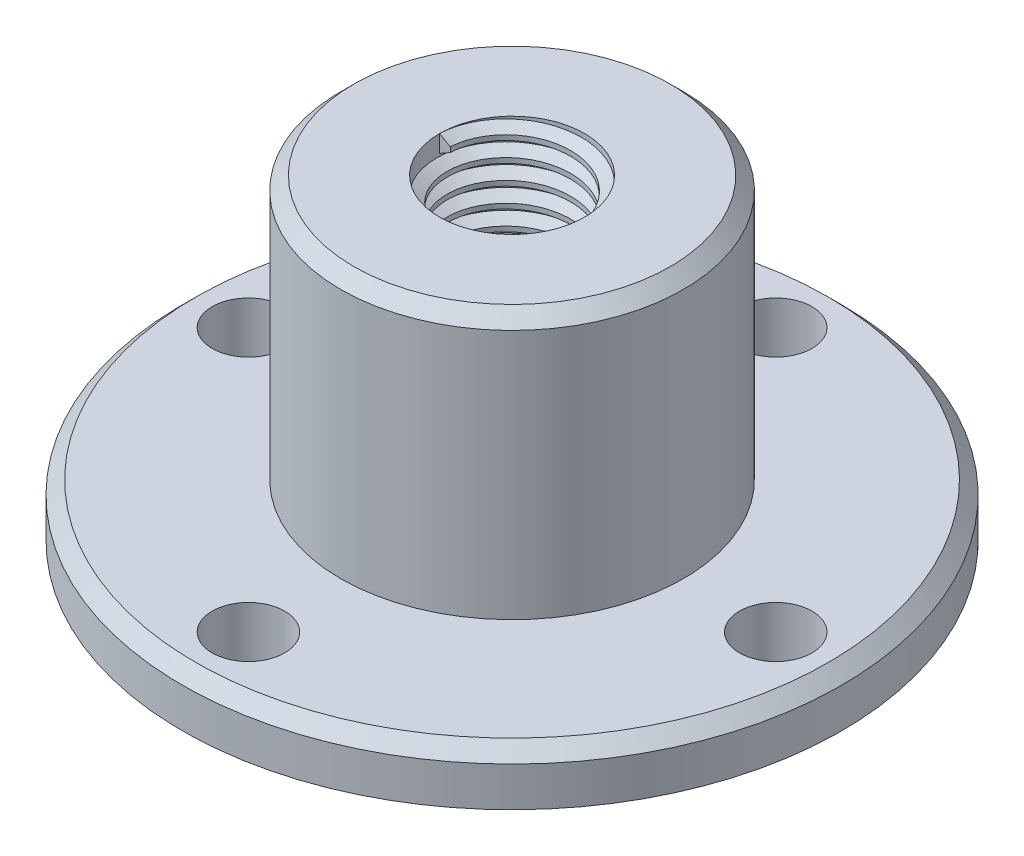
from build123d import *
from build123d.topology import SkipClean

# Parameters (mm, degrees)
SKIZZE1_R                       = 13
SKIZZE1_R_2                     = 5.5
AUFSATZ_LINEAR_AUSTRAGEN1_DEPTH = 20
AUFSATZ_LINEAR_START            = 4
SKIZZE5_R                       = 25
SKIZZE5_R_2                     = 5.5
AUFSATZ_LINEAR_AUSTRAGEN2_DEPTH = 4
GEWINDE1_PITCH                  = 1.5
DURCHGANGSLOCH_F_R_M51_D        = 5.5
DURCHGANGSLOCH_F_R_M51_DEPTH    = 25
DURCHGANGSLOCH_F_R_M51_TIP      = 1.652366702
FASE1_SIZE                      = 1
SKIZZE9_R                       = 8.038630934
SCHNITT_LINEAR_AUSTRAGEN1_DEPTH = 10


with BuildPart() as part:
    # Skizze1 → Aufsatz-Linear austragen1 (new body)
    with BuildSketch(Plane(origin=(0, 0, 0), x_dir=(1, 0, 0), z_dir=(0, 1, 0))):
        with Locations(Location((0, 0, 0), (0, 0, 270))):
            Circle(SKIZZE1_R)
        with Locations(Location((0, 0, 0), (0, 0, 270))):
            Circle(SKIZZE1_R_2, mode=Mode.SUBTRACT)
    extrude(amount=AUFSATZ_LINEAR_AUSTRAGEN1_DEPTH)

    # Skizze5 → Aufsatz-Linear austragen2 (add)
    with SkipClean():  # the faces are left unmerged after this step: merging them gives an invalid solid
        with BuildSketch(Plane.XZ.offset(AUFSATZ_LINEAR_START)):
            with Locations(Location((0, 0, 0), (0, 0, 270))):
                Circle(SKIZZE5_R)
            with Locations(Location((0, 0, 0), (0, 0, 270))):
                Circle(SKIZZE5_R_2, mode=Mode.SUBTRACT)
        extrude(amount=-AUFSATZ_LINEAR_AUSTRAGEN2_DEPTH)

    # Gewinde1: the profile of Gewindeprofil1 profile screwed along a right-hand helix of 16 turns, 8 arcs to a turn; built about Z, then put on its axis
    gewinde1_z = Axis((0, 0, 0), (0, 0, 1))
    gewinde1_corners = [(5.5003, 0, -0.000173205), (5.5003, 0, 1.312673201), (4.688101188, 0, 0.843749998), (4.688101188, 0, 0.468749998)]
    with BuildLine(mode=Mode.PRIVATE) as gewinde1_profile:
        Line(gewinde1_corners[0], gewinde1_corners[1])
        Line(gewinde1_corners[1], gewinde1_corners[2])
        Line(gewinde1_corners[2], gewinde1_corners[3])
        Line(gewinde1_corners[3], gewinde1_corners[0])
    gewinde1_cap = Face(gewinde1_profile.wire())
    gewinde1_turn_angles = [0, 22.5, 45, 67.5, 90, 112.5, 135, 157.5, 180, 202.5, 225, 247.5, 270, 292.5, 315, 337.5, 360]
    gewinde1_turn_weights = [1, 0.9238795325112867, 1, 0.9238795325112867, 1, 0.9238795325112867, 1, 0.9238795325112867, 1, 0.9238795325112867, 1, 0.9238795325112867, 1, 0.9238795325112867, 1, 0.9238795325112867, 1]
    gewinde1_turn_rails = [Edge.make_bspline([Vector(p[0], p[1], 0).rotate(gewinde1_z, gewinde1_turn_angles[k]) / gewinde1_turn_weights[k] + Vector(0, 0, p[2] + GEWINDE1_PITCH * gewinde1_turn_angles[k] / 360) for k in range(17)], [0, 0, 0, 1, 1, 2, 2, 3, 3, 4, 4, 5, 5, 6, 6, 7, 7, 8, 8, 8], 2, gewinde1_turn_weights) for p in gewinde1_corners]
    gewinde1_turn_sides = [Face.make_surface_from_curves(gewinde1_turn_rails[p[0]], gewinde1_turn_rails[p[1]]) for p in [(0, 1), (1, 2), (2, 3), (3, 0)]]
    gewinde1 = Plane(origin=(0, 20, 0), x_dir=(-1, 0, 0), z_dir=(0, -1, 0)) * Solid(Shell([*[p.moved(Location((0, 0, GEWINDE1_PITCH * i))) for i in range(16) for p in gewinde1_turn_sides], gewinde1_cap, gewinde1_cap.rotate(gewinde1_z, 5760).moved(Location((0, 0, GEWINDE1_PITCH * 5760 / 360)))]))
    add(gewinde1)

    # Durchgangsloch für M51
    with Locations(Plane(origin=(0, -4, 0), x_dir=(-1, 0, 0), z_dir=(0, -1, 0))):
        with Locations((0, 20), (20, 0), (0, -20), (-20, 0)):
            Hole(DURCHGANGSLOCH_F_R_M51_D / 2, depth=DURCHGANGSLOCH_F_R_M51_DEPTH)
            with Locations((0, 0, -(DURCHGANGSLOCH_F_R_M51_DEPTH + DURCHGANGSLOCH_F_R_M51_TIP / 2))):  # 118° drill point
                Cone(0, DURCHGANGSLOCH_F_R_M51_D / 2, DURCHGANGSLOCH_F_R_M51_TIP, mode=Mode.SUBTRACT)

    # Fase1
    fase1_edges = [part.edges().sort_by_distance(p)[0] for p in [
        (0, 0, 25),
        (0, 20, -13),
    ]]
    chamfer(fase1_edges, length=FASE1_SIZE)

    # Skizze9 → Schnitt-Linear austragen1 (cut)
    with BuildSketch(Plane.XZ.offset(4)):
        Circle(SKIZZE9_R)
    extrude(amount=SCHNITT_LINEAR_AUSTRAGEN1_DEPTH, mode=Mode.SUBTRACT)


solid = part.part
